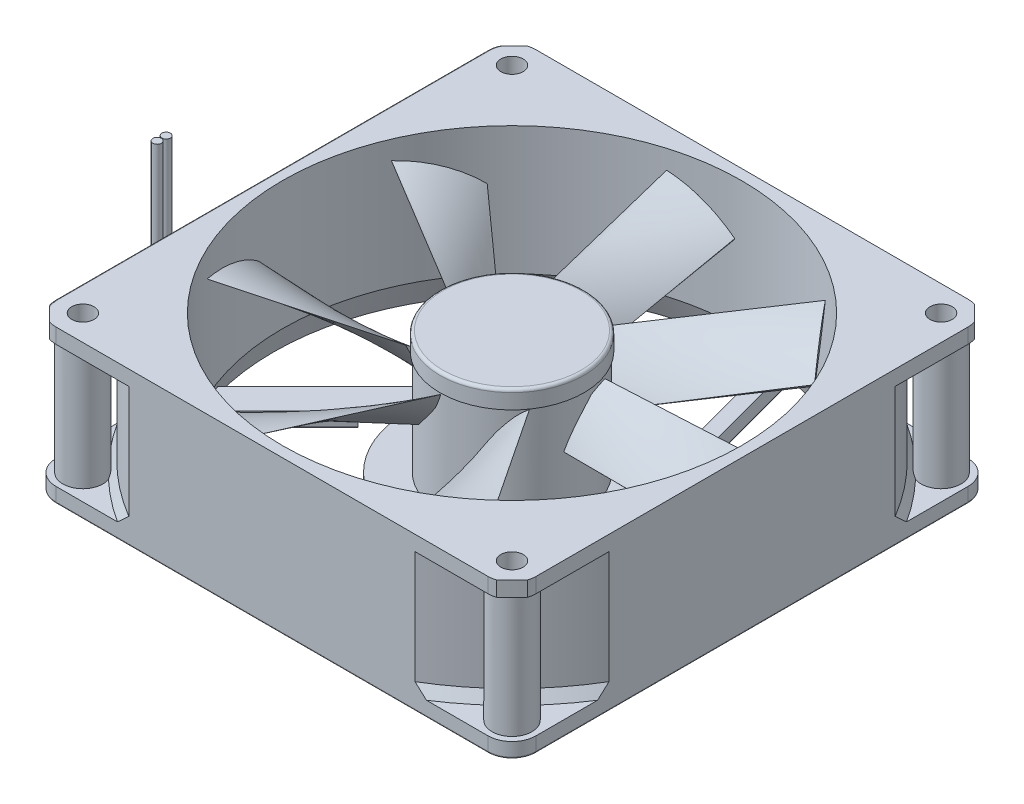
from build123d import *

# Parameters (mm, degrees)
SKETCH1_W                    = 80
SKETCH1_H                    = 80
MAIN_BODY_DEPTH              = 25.5
SKETCH2_R                    = 38.25
FAN_HOLE_CUT_DEPTH           = 63.050382755
FAN_HOLE_FRONT_CHAMFER_SIZE  = 1.5
FAN_HOLE_FRONT_CHAMFER_SIZE2 = 4.121216129
FAN_SUPPORT_DEPTH            = 2.5
SKETCH4_R                    = 11.75
PCB_DEPTH                    = 17.5
SKETCH5_R                    = 12
FAN_BODY_DEPTH               = 3
SKETCH6_W                    = 10
SKETCH6_H                    = 20.5
SKETCH7_R                    = 3.33
MOUNT_SCREW_EXTRUDE_DEPTH    = 25.5
SKETCH8_R                    = 1.85
MOUNT_SCREW_HOLES_DEPTH      = 25.5
CORNER_FILLETS_R             = 4
FAN_BLADES_CIRPATTERN_COUNT  = 7
SKETCH12_R                   = 55
SKETCH12_R_2                 = 54.5
FAN_BLADE_END_TRIM_DEPTH     = 23
WIRE_CHANNEL_DEPTH           = 2
SKETCH17_R                   = 10
LABEL_DEPTH                  = 0.2
LABEL_TEXT_DEPTH             = 0.05
FRONT_EDGE_FILLET_R          = 0.25
REAR_EDGE_FILLET_R           = 0.25
FAN_BODY_FILLET_R            = 0.5
OUTER_CUT_CHAMFER_SIZE       = 1.732050808
OUTER_CUT_CHAMFER_SIZE_2     = 1
SKETCH19_R                   = 0.71


# Some blends are built 0.0001 mm under size
with BuildPart() as part:
    # Sketch1 → Main Body (new body)
    with BuildSketch(Plane(origin=(0, 0, 0), x_dir=(1, 0, 0), z_dir=(0, 1, 0))):
        Rectangle(SKETCH1_W, SKETCH1_H)
    extrude(amount=MAIN_BODY_DEPTH)

    # Sketch2 → Fan Hole Cut (cut, through all)
    with BuildSketch(Plane.XZ):
        with Locations(Location((0, 0, 0), (0, 0, 270))):
            Circle(SKETCH2_R)
    extrude(amount=-FAN_HOLE_CUT_DEPTH, mode=Mode.SUBTRACT)

    # Fan Hole Front Chamfer
    fan_hole_front_chamfer_edges = [part.edges().sort_by_distance(p)[0] for p in [
        (0, 0, 38.25),
    ]]
    fan_hole_front_chamfer_side = [part.faces().sort_by_distance(p)[0] for p in [
        (0, 0, -38.86862915),
    ]]
    chamfer(fan_hole_front_chamfer_edges, length=FAN_HOLE_FRONT_CHAMFER_SIZE, length2=FAN_HOLE_FRONT_CHAMFER_SIZE2, reference=fan_hole_front_chamfer_side[0])

    # Sketch3 → Fan Support (add)
    with BuildSketch(Plane.XZ):
        with BuildLine():
            Line((-4.529333289, 16.90370196), (29.945052018, 26.141085663))
            ThreePointArc((29.945052018, 26.141085663), (30.828125874, 25.093607853), (31.674577576, 24.016320188))
            Line((31.674577576, 24.016320188), (4.824452061, 16.82185074))
            ThreePointArc((4.824452061, 16.82185074), (15.231429157, 8.617050879), (16.90370196, -4.529333289))
            Line((16.90370196, -4.529333289), (7.666318257, -39.003718597))
            ThreePointArc((7.666318257, -39.003718597), (6.317638936, -39.244744085), (4.9614546, -39.439148929))
            Line((4.9614546, -39.439148929), (12.155924049, -12.589023414))
            ThreePointArc((12.155924049, -12.589023414), (-0.153129611, -17.499330025), (-12.374368671, -12.374368671))
            Line((-12.374368671, -12.374368671), (-37.611370276, 12.862632934))
            ThreePointArc((-37.611370276, 12.862632934), (-36.650573499, 15.388241036), (-35.52040612, 17.842736591))
            Line((-35.52040612, 17.842736591), (-17.499088803, -0.178580727))
            ThreePointArc((-17.499088803, -0.178580727), (-13.937859965, 10.582346601), (-4.529333289, 16.90370196))
        make_face()
    extrude(amount=-FAN_SUPPORT_DEPTH)

    # Sketch4 → PCB (add)
    with BuildSketch(Plane(origin=(0, 2.5, 0), x_dir=(-1, 0, 0), z_dir=(0, 1, 0))):
        with Locations(Location((0, 0, 0), (0, 0, 270))):
            Circle(SKETCH4_R)
    extrude(amount=PCB_DEPTH)

    # Sketch5 → Fan Body (add)
    with BuildSketch(Plane(origin=(0, 20, 0), x_dir=(-1, 0, 0), z_dir=(0, 1, 0))):
        with Locations(Location((0, 0, 0), (0, 0, 90))):
            Circle(SKETCH5_R)
    extrude(amount=FAN_BODY_DEPTH)

    # Sketch6 → Outer Cut-Revolve1 (revolve, cut)
    with BuildSketch(Plane(origin=(0, 0, 0), x_dir=(-0.7071067811865474, 0, 0.7071067811865478), z_dir=(-0.7071067811865478, 0, -0.7071067811865474))):
        with Locations((-51.568542495, 12.75)):
            Rectangle(SKETCH6_W, SKETCH6_H)
    revolve(axis=Axis((0, 25.5, 0), (0, -1, 0)), mode=Mode.SUBTRACT)

    # Sketch7 → Mount Screw Extrude (add)
    with BuildSketch(Plane(origin=(0, 0, 0), x_dir=(1, 0, 0), z_dir=(0, 1, 0))):
        with Locations(Location((35.75, 35.75, 0), (0, 0, 90))):
            Circle(SKETCH7_R)
        with Locations(Location((-35.75, 35.75, 0), (0, 0, 90))):
            Circle(SKETCH7_R)
        with Locations(Location((-35.75, -35.75, 0), (0, 0, 90))):
            Circle(SKETCH7_R)
        with Locations(Location((35.75, -35.75, 0), (0, 0, 90))):
            Circle(SKETCH7_R)
    extrude(amount=MOUNT_SCREW_EXTRUDE_DEPTH)

    # Sketch8 → Mount Screw Holes (cut)
    with BuildSketch(Plane(origin=(0, 0, 0), x_dir=(1, 0, 0), z_dir=(0, 1, 0))):
        with Locations(Location((35.75, 35.75, 0), (0, 0, 270))):
            Circle(SKETCH8_R)
        with Locations(Location((-35.75, 35.75, 0), (0, 0, 270))):
            Circle(SKETCH8_R)
        with Locations(Location((-35.75, -35.75, 0), (0, 0, 270))):
            Circle(SKETCH8_R)
        with Locations(Location((35.75, -35.75, 0), (0, 0, 270))):
            Circle(SKETCH8_R)
    extrude(amount=MOUNT_SCREW_HOLES_DEPTH, mode=Mode.SUBTRACT)

    # Corner Fillets
    corner_fillets_edges = [part.edges().sort_by_distance(p)[0] for p in [
        (-40, 1.25, -40),
        (40, 1.25, -40),
        (-40, 24.25, -40),
        (40, 24.25, -40),
        (40, 1.25, 40),
        (40, 24.25, 40),
        (-40, 24.25, 40),
        (-40, 1.25, 40),
    ]]
    fillet(corner_fillets_edges, radius=CORNER_FILLETS_R)

    # Sketch11 for Fan Blade → Fan Blade section 0
    with BuildSketch(Plane.XY.offset(-36)):
        with BuildLine():
            Line((0.88314284, 18.423934195), (1.116801935, 18.804017109))
            # circular arc as an exact rational Bezier (weights 1, cos(half-angle), 1)
            Bezier((1.116801935, 18.804017109), (-3.902507001, 22.677639097), (-10.234528239, 23), weights=[1, 0.954384892, 1])
            Bezier((-10.234528239, 23), (-4.950325999, 20.044738342), (0.88314284, 18.423934195), weights=[1, 0.992873278, 1])
        make_face()
    # Sketch10 for Fan Blade → Fan Blade section 1
    with BuildSketch(Plane.XY.offset(-11)):
        with BuildLine():
            Line((-0.264841591, 12.120041066), (0.154505279, 12.376596125))
            Bezier((0.154505279, 12.376596125), (-1.729772728, 17.300194782), (-6.030014715, 20.349825284), weights=[1, 0.957029937, 1])
            Bezier((-6.030014715, 20.349825284), (-3.649909268, 15.882932376), (-0.264841591, 12.120041066), weights=[1, 0.992626589, 1])
        make_face()
    fan_blade = loft()

    # Fan Blades CirPattern: Fan Blade ×7 about axis
    fan_blades_cirpattern_axis = Axis((0, 25.5, 0), (0, -1, 0))
    for i in range(1, FAN_BLADES_CIRPATTERN_COUNT):
        add(fan_blade.rotate(fan_blades_cirpattern_axis, i * 360 / FAN_BLADES_CIRPATTERN_COUNT))

    # Sketch12 → Fan Blade End Trim (cut)
    with BuildSketch(Plane(origin=(0, 25.5, 0), x_dir=(-1, 0, 0), z_dir=(0, 1, 0))):
        Circle(SKETCH12_R)
        Circle(SKETCH12_R_2, mode=Mode.SUBTRACT)
    extrude(amount=-FAN_BLADE_END_TRIM_DEPTH, mode=Mode.SUBTRACT)

    # Sketch13 → Wire Channel (cut)
    with BuildSketch(Plane.XZ):
        with BuildLine():
            Line((-40, 20.908116908), (-40, 16.665476221))
            Line((-40, 16.665476221), (-20.213203436, -3.121320344))
            ThreePointArc((-20.213203436, -3.121320344), (-19.239933389, -3.771638598), (-18.091883092, -4))
            Line((-18.091883092, -4), (-5.355287716, -4))
            Line((-5.355287716, -4), (-5.355287716, 4))
            Line((-5.355287716, 4), (-23.091883092, 4))
            Line((-23.091883092, 4), (-40, 20.908116908))
        make_face()
    extrude(amount=-WIRE_CHANNEL_DEPTH, mode=Mode.SUBTRACT)

    # Sketch17 → Label (add)
    with BuildSketch(Plane.XZ):
        with Locations(Location((0, 0, 0), (0, 0, 156.421821522))):
            Circle(SKETCH17_R)
    extrude(amount=LABEL_DEPTH)

    # Sketch18 → Label Text (add)
    # profile 1 of 12: a face of its own
    with BuildSketch(Plane.XZ.offset(0.2)):
        with BuildLine():
            Line((6.438054702, 4.24314157), (6.438054702, 3.221225985))
            add(Edge.make_bspline(
                [(6.438054702, 3.221225985), (6.437668392, 3.194554514), (6.436927311, 3.143389139), (6.429103805, 3.07010455), (6.416754792, 3.003656938), (6.399671802, 2.943974802), (6.376775339, 2.891280433), (6.348888839, 2.845405839), (6.315575768, 2.806595257), (6.277343095, 2.774780225), (6.234162227, 2.750413135), (6.186837234, 2.732366857), (6.135294888, 2.721023765), (6.079485942, 2.71690301), (6.019467861, 2.719022888), (5.955277525, 2.728406597), (5.886859954, 2.743816246), (5.840683002, 2.758599184), (5.816707299, 2.766274687)],
                knots=[0, 0, 0, 0, 1.321239014, 2.534606635, 3.646893816, 4.667198731, 5.603797824, 6.485657792, 7.317482625, 8.126881878, 8.937584847, 9.763010098, 10.628279458, 11.542958389, 12.528970477, 13.598371646, 14.753041856, 16, 16, 16, 16], degree=3))
            add(Edge.make_bspline(
                [(5.816707299, 2.766274687), (5.791655003, 2.775209779), (5.742303896, 2.792811227), (5.671983228, 2.82576358), (5.605640356, 2.862101412), (5.543541238, 2.903027162), (5.48547448, 2.947939147), (5.431747724, 2.997366053), (5.381891195, 3.050571146), (5.336957146, 3.10847267), (5.29592326, 3.170091629), (5.261288845, 3.236549527), (5.231380621, 3.306783483), (5.207124323, 3.381063341), (5.188458201, 3.459542995), (5.17528234, 3.541891146), (5.166938037, 3.62838736), (5.16587258, 3.687386103), (5.165327429, 3.717573388)],
                knots=[0, 0, 0, 0, 1.02770908, 2.024508209, 2.998267434, 3.94979454, 4.8965093, 5.832985081, 6.76916876, 7.711757751, 8.663284857, 9.62710664, 10.60428651, 11.611458153, 12.643986171, 13.71956153, 14.833191325, 16, 16, 16, 16], degree=3))
            Line((5.165327429, 3.717573388), (5.165327429, 4.052394817))
            Line((5.165327429, 4.052394817), (4.438054702, 4.299553908))
            Line((4.438054702, 4.299553908), (4.438054702, 4.922930531))
            Line((4.438054702, 4.922930531), (6.438054702, 4.24314157))
        make_face()
        with BuildLine():
            Line((5.580911845, 3.91116105), (5.580911845, 3.770333128))
            add(Edge.make_bspline(
                [(5.580911845, 3.770333128), (5.581032262, 3.756935234), (5.581267309, 3.730783485), (5.58410513, 3.69283252), (5.588936941, 3.657170996), (5.595820843, 3.624112032), (5.604222071, 3.593364863), (5.614880901, 3.565138026), (5.627282012, 3.539266132), (5.646251781, 3.508513717), (5.67370437, 3.474867468), (5.711228661, 3.440772858), (5.753361291, 3.413617486), (5.784135203, 3.40146469), (5.799661845, 3.395333128)],
                knots=[0, 0, 0, 0, 1.032192763, 2.014767802, 2.930247413, 3.803196531, 4.615069746, 5.383698589, 6.124980646, 6.822224991, 8.163692905, 9.455309558, 10.716104132, 12, 12, 12, 12], degree=3))
            add(Edge.make_bspline(
                [(5.799661845, 3.395333128), (5.814549106, 3.390793224), (5.842573959, 3.382246979), (5.884751483, 3.379392335), (5.923378706, 3.38436577), (5.95279218, 3.396010251), (5.973815796, 3.410273413), (5.986830941, 3.426132826), (5.99828884, 3.445194495), (6.00685068, 3.468419444), (6.01449307, 3.495062718), (6.018726403, 3.525917891), (6.02233072, 3.560427226), (6.022422293, 3.584714596), (6.022470286, 3.597443518)],
                knots=[0, 0, 0, 0, 1.472911506, 2.772714833, 3.978307946, 5.141737742, 5.740212137, 6.368251784, 7.070626824, 7.843076147, 8.708987991, 9.696805147, 10.792903908, 12, 12, 12, 12], degree=3))
            Line((6.022470286, 3.597443518), (6.022470286, 3.760998713))
            Line((6.022470286, 3.760998713), (5.580911845, 3.91116105))
        make_face(mode=Mode.SUBTRACT)
    # profile 2 of 12: a face of its own
    with BuildSketch(Plane.XZ.offset(0.2)):
        Polygon((4.775717039, 1.559294167), (4.775717039, 2.255722739), (4.438054702, 2.47163183), (4.438054702, 3.104748713), (6.438054702, 1.692005206), (6.438054702, 0.988677284), (4.438054702, 0.922930531), (4.438054702, 1.573092869), align=None)
        Polygon((5.217275481, 1.541437024), (5.926691065, 1.520738973), (5.217275481, 1.97366105), align=None, mode=Mode.SUBTRACT)
    # profile 3 of 12: a face of its own
    with BuildSketch(Plane.XZ.offset(0.2)):
        with BuildLine():
            Line((6.438054702, 0.035349362), (6.438054702, -0.986566222))
            add(Edge.make_bspline(
                [(6.438054702, -0.986566222), (6.437668392, -1.013237694), (6.436927311, -1.064403069), (6.429103805, -1.137687658), (6.416754792, -1.20413527), (6.399671802, -1.263817406), (6.376775339, -1.316511774), (6.348888839, -1.362386369), (6.315575768, -1.401196951), (6.277343095, -1.433011982), (6.234162227, -1.457379073), (6.186837234, -1.47542535), (6.135294888, -1.486768443), (6.079485942, -1.490889198), (6.019467861, -1.488769319), (5.955277525, -1.479385611), (5.886859954, -1.463975962), (5.840683002, -1.449193024), (5.816707299, -1.441517521)],
                knots=[0, 0, 0, 0, 1.321239014, 2.534606635, 3.646893816, 4.667198731, 5.603797824, 6.485657792, 7.317482625, 8.126881878, 8.937584847, 9.763010098, 10.628279458, 11.542958389, 12.528970477, 13.598371646, 14.753041856, 16, 16, 16, 16], degree=3))
            add(Edge.make_bspline(
                [(5.816707299, -1.441517521), (5.791655003, -1.432582429), (5.742303896, -1.414980981), (5.671983228, -1.382028628), (5.605640356, -1.345690796), (5.543541238, -1.304765046), (5.48547448, -1.25985306), (5.431747724, -1.210426155), (5.381891195, -1.157221062), (5.336957146, -1.099319538), (5.29592326, -1.037700579), (5.261288845, -0.97124268), (5.231380621, -0.901008725), (5.207124323, -0.826728866), (5.188458201, -0.748249213), (5.17528234, -0.665901062), (5.166938037, -0.579404848), (5.16587258, -0.520406105), (5.165327429, -0.49021882)],
                knots=[0, 0, 0, 0, 1.02770908, 2.024508209, 2.998267434, 3.94979454, 4.8965093, 5.832985081, 6.76916876, 7.711757751, 8.663284857, 9.62710664, 10.60428651, 11.611458153, 12.643986171, 13.71956153, 14.833191325, 16, 16, 16, 16], degree=3))
            Line((5.165327429, -0.49021882), (5.165327429, -0.155397391))
            Line((5.165327429, -0.155397391), (4.438054702, 0.0917617))
            Line((4.438054702, 0.0917617), (4.438054702, 0.715138323))
            Line((4.438054702, 0.715138323), (6.438054702, 0.035349362))
        make_face()
        with BuildLine():
            Line((5.580911845, -0.296631157), (5.580911845, -0.437459079))
            add(Edge.make_bspline(
                [(5.580911845, -0.437459079), (5.581032262, -0.450856974), (5.581267309, -0.477008723), (5.58410513, -0.514959688), (5.588936941, -0.550621212), (5.595820843, -0.583680175), (5.604222071, -0.614427344), (5.614880901, -0.642654182), (5.627282012, -0.668526076), (5.646251781, -0.699278491), (5.67370437, -0.732924739), (5.711228661, -0.767019349), (5.753361291, -0.794174722), (5.784135203, -0.806327518), (5.799661845, -0.812459079)],
                knots=[0, 0, 0, 0, 1.032192763, 2.014767802, 2.930247413, 3.803196531, 4.615069746, 5.383698589, 6.124980646, 6.822224991, 8.163692905, 9.455309558, 10.716104132, 12, 12, 12, 12], degree=3))
            add(Edge.make_bspline(
                [(5.799661845, -0.812459079), (5.814549106, -0.816998984), (5.842573959, -0.825545228), (5.884751483, -0.828399873), (5.923378706, -0.823426438), (5.95279218, -0.811781957), (5.973815796, -0.797518795), (5.986830941, -0.781659381), (5.99828884, -0.762597713), (6.00685068, -0.739372763), (6.01449307, -0.71272949), (6.018726403, -0.681874317), (6.02233072, -0.647364981), (6.022422293, -0.623077612), (6.022470286, -0.61034869)],
                knots=[0, 0, 0, 0, 1.472911506, 2.772714833, 3.978307946, 5.141737742, 5.740212137, 6.368251784, 7.070626824, 7.843076147, 8.708987991, 9.696805147, 10.792903908, 12, 12, 12, 12], degree=3))
            Line((6.022470286, -0.61034869), (6.022470286, -0.446793495))
            Line((6.022470286, -0.446793495), (5.580911845, -0.296631157))
        make_face(mode=Mode.SUBTRACT)
    # profile 4 of 12: a face of its own
    with BuildSketch(Plane.XZ.offset(0.2)):
        with BuildLine():
            Line((5.102827429, -1.432994794), (5.139353403, -2.068546742))
            add(Edge.make_bspline(
                [(5.139353403, -2.068546742), (5.117096382, -2.064166446), (5.075652555, -2.056010089), (5.016763686, -2.051253897), (4.96586012, -2.053335859), (4.935934192, -2.061819806), (4.92222678, -2.065705833)],
                knots=[0, 0, 0, 0, 1.23814647, 2.305498509, 3.223842548, 4, 4, 4, 4], degree=3))
            add(Edge.make_bspline(
                [(4.92222678, -2.065705833), (4.912577447, -2.069831508), (4.893796144, -2.077861655), (4.869041, -2.095427958), (4.848004611, -2.116389197), (4.830833382, -2.140983872), (4.817655887, -2.169288619), (4.808586892, -2.201070288), (4.802794985, -2.236358271), (4.80206965, -2.261027772), (4.801691065, -2.273903885)],
                knots=[0, 0, 0, 0, 0.975390683, 1.898484477, 2.807532068, 3.730625862, 4.67784135, 5.702786696, 6.800981908, 8, 8, 8, 8], degree=3))
            add(Edge.make_bspline(
                [(4.801691065, -2.273903885), (4.802498272, -2.293436103), (4.804065536, -2.331359651), (4.815422837, -2.386165154), (4.835321751, -2.436284094), (4.861859796, -2.481664535), (4.894267044, -2.520357076), (4.928923876, -2.553192365), (4.966474515, -2.578600082), (4.993703163, -2.589556672), (5.007048208, -2.594926612)],
                knots=[0, 0, 0, 0, 1.155200031, 2.242924085, 3.292134734, 4.332518028, 5.33875951, 6.267446417, 7.15085738, 8, 8, 8, 8], degree=3))
            add(Edge.make_bspline(
                [(5.007048208, -2.594926612), (5.019526715, -2.598562158), (5.043479343, -2.605540628), (5.080098428, -2.607271173), (5.114806044, -2.600851149), (5.135477202, -2.590689698), (5.14584691, -2.585592196)],
                knots=[0, 0, 0, 0, 1.084010536, 2.080769929, 3.037216232, 4, 4, 4, 4], degree=3))
            add(Edge.make_bspline(
                [(5.14584691, -2.585592196), (5.151022334, -2.581717103), (5.162443938, -2.573165191), (5.177374583, -2.554403423), (5.19207808, -2.530043683), (5.206774933, -2.499610281), (5.220525307, -2.463047481), (5.23488269, -2.420757256), (5.248477605, -2.372318435), (5.257010297, -2.337916266), (5.261512494, -2.319764274)],
                knots=[0, 0, 0, 0, 0.524739567, 1.158043661, 1.934578711, 2.841114677, 3.904892628, 5.113702067, 6.477071084, 8, 8, 8, 8], degree=3))
            add(Edge.make_bspline(
                [(5.261512494, -2.319764274), (5.269049855, -2.289646017), (5.283538044, -2.231753213), (5.309365719, -2.14965124), (5.336163556, -2.075193292), (5.365399267, -2.008722956), (5.396406494, -1.950090183), (5.429449635, -1.899490998), (5.463469589, -1.855902811), (5.489656195, -1.832553026), (5.502178078, -1.821387651)],
                knots=[0, 0, 0, 0, 1.325913313, 2.548648162, 3.674782594, 4.704496492, 5.648111819, 6.503991685, 7.28464036, 8, 8, 8, 8], degree=3))
            add(Edge.make_bspline(
                [(5.502178078, -1.821387651), (5.514911096, -1.811795605), (5.540085365, -1.792831307), (5.582095977, -1.77140759), (5.626325293, -1.755449311), (5.673385076, -1.747306321), (5.722854816, -1.744890128), (5.774757627, -1.748670482), (5.829344181, -1.758945933), (5.865649522, -1.770398051), (5.884483273, -1.77633895)],
                knots=[0, 0, 0, 0, 0.947154688, 1.872606022, 2.79437287, 3.735554791, 4.702888461, 5.735967942, 6.825511188, 8, 8, 8, 8], degree=3))
            add(Edge.make_bspline(
                [(5.884483273, -1.77633895), (5.90978164, -1.786155393), (5.961309746, -1.806149677), (6.034945021, -1.84814972), (6.105838055, -1.900961847), (6.174681218, -1.962718102), (6.239115957, -2.034101), (6.29610361, -2.115419237), (6.346274842, -2.20504912), (6.380892839, -2.286497678), (6.405167886, -2.35605185), (6.420968004, -2.412306346), (6.434203605, -2.471807553), (6.445211331, -2.534638359), (6.453632667, -2.600732821), (6.459646237, -2.67018778), (6.463366855, -2.742883549), (6.463804994, -2.792432895), (6.464028728, -2.817735053)],
                knots=[0, 0, 0, 0, 1.021401127, 2.080405608, 3.18144864, 4.347238126, 5.560008286, 6.796056353, 8.080804308, 9.423411821, 10.124624676, 10.855589171, 11.623526398, 12.420468821, 13.25817982, 14.13314852, 15.046700397, 16, 16, 16, 16], degree=3))
            add(Edge.make_bspline(
                [(6.464028728, -2.817735053), (6.463753984, -2.848324999), (6.463225599, -2.907155487), (6.45603971, -2.991693658), (6.445444948, -3.069170921), (6.430174646, -3.139672421), (6.410470899, -3.203019168), (6.386680581, -3.259531772), (6.357636431, -3.308483419), (6.324784887, -3.351111272), (6.286365618, -3.386297442), (6.242593663, -3.414121053), (6.193925173, -3.435483613), (6.13974472, -3.449034421), (6.080730007, -3.456241289), (6.016502259, -3.456280115), (5.947190201, -3.449746125), (5.89983529, -3.440335619), (5.875148858, -3.435429859)],
                knots=[0, 0, 0, 0, 1.410707891, 2.713069044, 3.91068441, 5.01603595, 6.036455415, 6.96732192, 7.837447019, 8.655172524, 9.441431441, 10.227343563, 11.037773675, 11.882370742, 12.794195047, 13.773980209, 14.83956096, 16, 16, 16, 16], degree=3))
            Line((5.875148858, -3.435429859), (5.840652104, -2.800689599))
            add(Edge.make_bspline(
                [(5.840652104, -2.800689599), (5.851587468, -2.802613451), (5.872563679, -2.806303782), (5.903232353, -2.809001402), (5.931441272, -2.810098018), (5.957388147, -2.808418428), (5.981026255, -2.804794002), (6.002578789, -2.799428014), (6.021709782, -2.791096616), (6.043986485, -2.777011927), (6.067525645, -2.752890237), (6.087441771, -2.715099686), (6.098268915, -2.668426708), (6.09964968, -2.634620168), (6.100392364, -2.616436352)],
                knots=[0, 0, 0, 0, 1.037191525, 1.989540444, 2.874914227, 3.673029443, 4.415101435, 5.108165953, 5.74233749, 6.356143616, 7.563073699, 8.841521751, 10.301121969, 12, 12, 12, 12], degree=3))
            add(Edge.make_bspline(
                [(6.100392364, -2.616436352), (6.099894669, -2.60083736), (6.098938648, -2.570873324), (6.090287566, -2.527826823), (6.075714757, -2.489034474), (6.055587185, -2.454728844), (6.031716494, -2.425229779), (6.005098407, -2.400384255), (5.975720571, -2.380922358), (5.954321991, -2.372316756), (5.94373652, -2.368059729)],
                knots=[0, 0, 0, 0, 1.192946755, 2.291526244, 3.343442199, 4.35036656, 5.322236406, 6.238166495, 7.128454468, 8, 8, 8, 8], degree=3))
            add(Edge.make_bspline(
                [(5.94373652, -2.368059729), (5.936087094, -2.365803839), (5.921361376, -2.361461081), (5.898459612, -2.363222606), (5.87647326, -2.369860623), (5.864353339, -2.379383031), (5.858103403, -2.384293495)],
                knots=[0, 0, 0, 0, 1.037027792, 1.996356192, 2.966771692, 4, 4, 4, 4], degree=3))
            add(Edge.make_bspline(
                [(5.858103403, -2.384293495), (5.854736485, -2.387294618), (5.847236631, -2.393979658), (5.837832112, -2.40769274), (5.82850253, -2.425026367), (5.819264177, -2.446064475), (5.810508557, -2.470972569), (5.801555997, -2.499528043), (5.792624926, -2.531850043), (5.787390162, -2.554859609), (5.784645611, -2.566923365)],
                knots=[0, 0, 0, 0, 0.541143888, 1.205404861, 1.984936319, 2.910560029, 3.966197064, 5.160691536, 6.51137023, 8, 8, 8, 8], degree=3))
            add(Edge.make_bspline(
                [(5.784645611, -2.566923365), (5.777436275, -2.597114634), (5.763604309, -2.65504016), (5.742097432, -2.738328563), (5.720406641, -2.814283596), (5.698332883, -2.883115569), (5.676948991, -2.944845097), (5.654125077, -2.998964355), (5.632955825, -3.046620645), (5.610048508, -3.087043383), (5.586973998, -3.12238827), (5.562672222, -3.153606169), (5.53710202, -3.181414251), (5.509936692, -3.205585992), (5.481714151, -3.226766793), (5.451919245, -3.24435638), (5.420710142, -3.258276839), (5.388302372, -3.268761131), (5.354704506, -3.276056335), (5.320216187, -3.280479061), (5.284783896, -3.282133485), (5.248456644, -3.280673283), (5.21095969, -3.27728933), (5.172570351, -3.269984236), (5.132962995, -3.261007636), (5.106823166, -3.252346602), (5.093493013, -3.247929859)],
                knots=[0, 0, 0, 0, 1.954233659, 3.749428709, 5.415411101, 6.926515922, 8.30040468, 9.526233733, 10.623766169, 11.580921462, 12.447880865, 13.279303009, 14.068836087, 14.822838694, 15.565548193, 16.287153388, 16.996285579, 17.712745394, 18.427786273, 19.157787157, 19.899568177, 20.658031384, 21.445356231, 22.267345297, 23.116422969, 24, 24, 24, 24], degree=3))
            add(Edge.make_bspline(
                [(5.093493013, -3.247929859), (5.077580651, -3.242187601), (5.04577019, -3.230708235), (4.999427268, -3.209644078), (4.953612853, -3.186296058), (4.909320564, -3.158755643), (4.865175258, -3.12938726), (4.822652212, -3.09619638), (4.780680825, -3.06045213), (4.739924048, -3.021804936), (4.701243729, -2.980328347), (4.663997426, -2.93755638), (4.630166142, -2.892138531), (4.597717872, -2.845678998), (4.568831655, -2.796651778), (4.541225036, -2.74647061), (4.517250971, -2.693859136), (4.494554318, -2.639938215), (4.475208043, -2.583601937), (4.458071473, -2.525279107), (4.443997573, -2.464530456), (4.432134895, -2.401732583), (4.423364112, -2.336687171), (4.416904924, -2.26954144), (4.412642259, -2.200095408), (4.412269913, -2.152968717), (4.412080676, -2.129017521)],
                knots=[0, 0, 0, 0, 0.869406598, 1.738033859, 2.615278472, 3.51110315, 4.41777044, 5.340121929, 6.28237259, 7.251551565, 8.225783632, 9.197455099, 10.165635281, 11.136036377, 12.109374243, 13.089670182, 14.079200035, 15.080224991, 16.096453832, 17.13974175, 18.204281758, 19.301052569, 20.424363576, 21.577363251, 22.768743441, 24, 24, 24, 24], degree=3))
            add(Edge.make_bspline(
                [(4.412080676, -2.129017521), (4.412216235, -2.108180959), (4.41248041, -2.067575246), (4.415119122, -2.008178573), (4.418564272, -1.951722423), (4.423858582, -1.898119122), (4.430609722, -1.847460148), (4.439289981, -1.799857003), (4.448777164, -1.755217417), (4.460207239, -1.713635864), (4.473096081, -1.674965629), (4.487810066, -1.639275865), (4.503390756, -1.606245494), (4.521017876, -1.576443852), (4.539935756, -1.549493751), (4.56085618, -1.525937945), (4.582797961, -1.504894206), (4.614398888, -1.48131449), (4.656673932, -1.456521467), (4.71104378, -1.433967472), (4.768410181, -1.417034473), (4.82917793, -1.406896725), (4.893277245, -1.404033517), (4.960502895, -1.406926281), (5.031013057, -1.416261387), (5.078422178, -1.427308146), (5.102827429, -1.432994794)],
                knots=[0, 0, 0, 0, 1.241238634, 2.418891308, 3.541481368, 4.610457218, 5.627145034, 6.585152786, 7.492532483, 8.3449928, 9.152896069, 9.919166659, 10.643698315, 11.326507995, 11.979511192, 12.601959322, 13.200576857, 13.787303591, 14.946976628, 16.110005369, 17.285698439, 18.503321455, 19.770274958, 21.101257504, 22.507786318, 24, 24, 24, 24], degree=3))
        make_face()
    # profile 5 of 12: a face of its own
    with BuildSketch(Plane.XZ.offset(0.2)):
        Polygon((6.438054702, -3.88672856), (6.438054702, -5.75685843), (5.970522234, -5.597767521), (5.970522234, -4.974390898), (4.438054702, -4.453692846), (4.438054702, -3.830316222), (5.970522234, -4.351014274), (5.970522234, -3.727637651), align=None)
    # profile 6 of 12: a face of its own
    with BuildSketch(Plane.XZ.offset(0.2)):
        Polygon((2.478822719, 7.112319327), (2.478822719, 7.462192637), (1.584397043, 7.462192637), (1.584397043, 7.593949394), (2.478822719, 7.593949394), (2.478822719, 7.941077773), (2.589886908, 7.941077773), (2.589886908, 7.112319327), align=None)
    # profile 7 of 12: a face of its own
    with BuildSketch(Plane.XZ.offset(0.2)):
        Polygon((2.589886908, 6.11337507), (1.968476435, 6.528282165), (1.584397043, 6.528282165), (1.584397043, 6.659405475), (1.968476435, 6.659405475), (2.589886908, 7.072623381), (2.589886908, 6.926508516), (2.073206165, 6.593738246), (2.589886908, 6.251043989), align=None)
    # profile 8 of 12: a face of its own
    with BuildSketch(Plane.XZ.offset(0.2)):
        with BuildLine():
            Line((2.589886908, 5.98985311), (2.589886908, 5.566711219))
            add(Edge.make_bspline(
                [(2.589886908, 5.566711219), (2.589682444, 5.553888636), (2.589282565, 5.528810923), (2.585025733, 5.492210738), (2.578933591, 5.457475091), (2.569783332, 5.424668486), (2.557873423, 5.393863976), (2.543863134, 5.364691717), (2.526695404, 5.33775175), (2.507454267, 5.31268366), (2.486026734, 5.290231332), (2.463062999, 5.270580196), (2.438637887, 5.253991888), (2.412714991, 5.240384176), (2.385293457, 5.229785367), (2.356419819, 5.222143418), (2.326091742, 5.217669107), (2.305414083, 5.217117871), (2.294912246, 5.216837908)],
                knots=[0, 0, 0, 0, 1.19836409, 2.343695477, 3.440862327, 4.493077171, 5.522132484, 6.52574879, 7.513511173, 8.503375834, 9.476206066, 10.409851199, 11.324304258, 12.230933306, 13.141399526, 14.067219118, 15.018372914, 16, 16, 16, 16], degree=3))
            add(Edge.make_bspline(
                [(2.294912246, 5.216837908), (2.284195608, 5.217100027), (2.263160139, 5.217614535), (2.232293876, 5.222327698), (2.202608105, 5.229249533), (2.174349508, 5.239888328), (2.147176459, 5.252931897), (2.121306672, 5.269042595), (2.096907231, 5.288321792), (2.073778759, 5.310081795), (2.052633335, 5.33454275), (2.034199596, 5.361444732), (2.01875266, 5.390605569), (2.006027078, 5.421869335), (1.996091053, 5.455313133), (1.989259762, 5.490965758), (1.984929057, 5.528738819), (1.984382263, 5.554663458), (1.984101435, 5.56797811)],
                knots=[0, 0, 0, 0, 0.976463228, 1.916679622, 2.841216179, 3.75079895, 4.663500378, 5.585896388, 6.523019777, 7.494472486, 8.477304363, 9.465193261, 10.461384589, 11.48028108, 12.538123678, 13.636831942, 14.786298951, 16, 16, 16, 16], degree=3))
            Line((1.984101435, 5.56797811), (1.984101435, 5.8587298))
            Line((1.984101435, 5.8587298), (1.584397043, 5.8587298))
            Line((1.584397043, 5.8587298), (1.584397043, 5.98985311))
            Line((1.584397043, 5.98985311), (2.589886908, 5.98985311))
        make_face()
        with BuildLine():
            Line((2.095376773, 5.8587298), (2.095376773, 5.581702773))
            add(Edge.make_bspline(
                [(2.095376773, 5.581702773), (2.095525148, 5.572757056), (2.095814349, 5.555320746), (2.098449941, 5.53000443), (2.102351669, 5.506188239), (2.108063676, 5.483928489), (2.115384536, 5.463170497), (2.124516896, 5.444103151), (2.135128278, 5.426574456), (2.147398258, 5.410722184), (2.161121649, 5.396535807), (2.17621285, 5.384203388), (2.192624338, 5.373716136), (2.210403404, 5.365351975), (2.229359975, 5.358707352), (2.249630086, 5.354175725), (2.271096201, 5.351051019), (2.285891498, 5.3508226), (2.293434205, 5.350706151)],
                knots=[0, 0, 0, 0, 1.243079824, 2.42291659, 3.534287429, 4.594939236, 5.6130011, 6.588821085, 7.528413798, 8.455960281, 9.369208367, 10.266118337, 11.159017659, 12.069221401, 12.991230862, 13.945228757, 14.952468667, 16, 16, 16, 16], degree=3))
            add(Edge.make_bspline(
                [(2.293434205, 5.350706151), (2.300198606, 5.350939763), (2.313431427, 5.351396764), (2.332799198, 5.354071255), (2.351122175, 5.359014921), (2.368431039, 5.36580846), (2.384932408, 5.37422043), (2.40017448, 5.384988085), (2.414602822, 5.397446233), (2.427863381, 5.41185788), (2.439938869, 5.427845483), (2.45025558, 5.445555651), (2.459266461, 5.464648803), (2.466223217, 5.485327691), (2.472099102, 5.507297563), (2.476001229, 5.530769581), (2.47831626, 5.555754829), (2.478650898, 5.572899721), (2.478822719, 5.581702773)],
                knots=[0, 0, 0, 0, 0.973866268, 1.905120358, 2.806981082, 3.698713683, 4.577753378, 5.465795399, 6.377840569, 7.316941442, 8.279358792, 9.255803589, 10.261962018, 11.312824711, 12.391543056, 13.532406627, 14.733013182, 16, 16, 16, 16], degree=3))
            Line((2.478822719, 5.581702773), (2.478822719, 5.8587298))
            Line((2.478822719, 5.8587298), (2.095376773, 5.8587298))
        make_face(mode=Mode.SUBTRACT)
    # profile 9 of 12: a face of its own
    with BuildSketch(Plane.XZ.offset(0.2)):
        with BuildLine():
            add(Edge.make_bspline(
                [(2.192927448, 4.493231489), (2.196126024, 4.481659333), (2.202492389, 4.458626407), (2.208926415, 4.423602972), (2.212880214, 4.388593825), (2.213373848, 4.365285684), (2.213620016, 4.353662232)],
                knots=[0, 0, 0, 0, 1.017264412, 2.02473732, 3.01496344, 4, 4, 4, 4], degree=3))
            add(Edge.make_bspline(
                [(2.213620016, 4.353662232), (2.213427313, 4.340417293), (2.213050085, 4.314489465), (2.208624202, 4.276668434), (2.201972001, 4.240774208), (2.192569873, 4.20683967), (2.179985596, 4.175099194), (2.165021216, 4.145308182), (2.147123783, 4.117673001), (2.126698947, 4.092259237), (2.10422686, 4.069138998), (2.079525925, 4.049256691), (2.053234384, 4.03212053), (2.024933191, 4.018454319), (1.995034374, 4.007550772), (1.96328206, 4.000060694), (1.92984376, 3.995241675), (1.906908634, 3.994749482), (1.895207854, 3.994498381)],
                knots=[0, 0, 0, 0, 1.175145952, 2.300424427, 3.375028993, 4.41342746, 5.42045379, 6.401167077, 7.368152767, 8.337033757, 9.291301545, 10.224099128, 11.146037622, 12.070892781, 13.007657157, 13.965334258, 14.961977492, 16, 16, 16, 16], degree=3))
            add(Edge.make_bspline(
                [(1.895207854, 3.994498381), (1.883367798, 3.994754866), (1.86015527, 3.995257707), (1.826194535, 4.000015152), (1.793942782, 4.007817592), (1.763330472, 4.018692016), (1.734156128, 4.032353687), (1.706873331, 4.049643455), (1.681198215, 4.069882468), (1.657121847, 4.092778859), (1.635512541, 4.118446476), (1.616610523, 4.146248085), (1.600628329, 4.176021288), (1.587862224, 4.207807717), (1.577617112, 4.241493026), (1.570258134, 4.277098606), (1.56604528, 4.314779556), (1.565474792, 4.340490061), (1.565182516, 4.353662232)],
                knots=[0, 0, 0, 0, 1.036281355, 2.03163826, 2.995767696, 3.937254529, 4.871796911, 5.810556635, 6.758656682, 7.730711463, 8.714727577, 9.690779271, 10.669609392, 11.667576811, 12.685273544, 13.748921305, 14.846712973, 16, 16, 16, 16], degree=3))
            add(Edge.make_bspline(
                [(1.565182516, 4.353662232), (1.56547878, 4.368311782), (1.566065422, 4.397319823), (1.570381689, 4.440364909), (1.577529123, 4.482497472), (1.587724294, 4.523677432), (1.600593125, 4.564006911), (1.616529122, 4.603249899), (1.635034015, 4.641742299), (1.649663048, 4.666266398), (1.657032178, 4.678620002)],
                knots=[0, 0, 0, 0, 1.027454133, 2.034494664, 3.031171617, 4.022601574, 5.007767522, 5.997869078, 6.991460032, 8, 8, 8, 8], degree=3))
            Line((1.657032178, 4.678620002), (1.759650421, 4.642302435))
            add(Edge.make_bspline(
                [(1.759650421, 4.642302435), (1.752867292, 4.631134754), (1.739463618, 4.609067068), (1.722492892, 4.574721894), (1.707840154, 4.540265574), (1.695685868, 4.505533537), (1.686370619, 4.47044552), (1.679902741, 4.435068774), (1.67564229, 4.399445038), (1.675201088, 4.375563447), (1.674979813, 4.363586219)],
                knots=[0, 0, 0, 0, 1.061853592, 2.098255757, 3.111090262, 4.104585832, 5.087261954, 6.059183477, 7.026630937, 8, 8, 8, 8], degree=3))
            add(Edge.make_bspline(
                [(1.674979813, 4.363586219), (1.675218501, 4.355415997), (1.675688977, 4.339311692), (1.678327651, 4.315674614), (1.683288447, 4.293082255), (1.690015826, 4.271607295), (1.698508762, 4.251044548), (1.709044999, 4.231644653), (1.721699489, 4.213354903), (1.735881108, 4.196168879), (1.751659893, 4.180517171), (1.768836271, 4.166977874), (1.787083399, 4.155468916), (1.806522595, 4.14615506), (1.826986881, 4.138645499), (1.848784873, 4.133726421), (1.871597816, 4.130404632), (1.887242209, 4.130033588), (1.895207854, 4.129844665)],
                knots=[0, 0, 0, 0, 1.08955317, 2.147615853, 3.165464819, 4.168630093, 5.144564689, 6.127153665, 7.105836426, 8.105484279, 9.094193138, 10.062927839, 11.015853071, 11.964378702, 12.932067474, 13.915373145, 14.938571982, 16, 16, 16, 16], degree=3))
            add(Edge.make_bspline(
                [(1.895207854, 4.129844665), (1.902886677, 4.130066564), (1.917950404, 4.130501871), (1.94001113, 4.13335311), (1.960825491, 4.138790849), (1.980489994, 4.145849685), (1.998940007, 4.15513445), (2.016293806, 4.166287771), (2.032443064, 4.179701931), (2.047091032, 4.195125077), (2.060419755, 4.21199708), (2.072069143, 4.230255907), (2.082010744, 4.249682059), (2.090063364, 4.270267739), (2.096181139, 4.291996389), (2.10054234, 4.314813702), (2.103428508, 4.338808243), (2.103689328, 4.355201978), (2.103822719, 4.363586219)],
                knots=[0, 0, 0, 0, 1.046580221, 2.05310086, 3.023177782, 3.972936706, 4.895174766, 5.831667431, 6.778515953, 7.748592875, 8.725285753, 9.7044246, 10.695331468, 11.694559215, 12.711672468, 13.766962852, 14.857958848, 16, 16, 16, 16], degree=3))
            add(Edge.make_bspline(
                [(2.103822719, 4.363586219), (2.103550181, 4.37500494), (2.10300808, 4.397717712), (2.098300761, 4.431309497), (2.091398532, 4.464356685), (2.084064137, 4.485554691), (2.080385219, 4.49618757)],
                knots=[0, 0, 0, 0, 1.011989988, 2.012931064, 3.003290015, 4, 4, 4, 4], degree=3))
            Line((2.080385219, 4.49618757), (2.101077786, 4.604506827))
            Line((2.101077786, 4.604506827), (2.589886908, 4.604506827))
            Line((2.589886908, 4.604506827), (2.589886908, 4.036516962))
            Line((2.589886908, 4.036516962), (2.473121705, 4.036516962))
            Line((2.473121705, 4.036516962), (2.473121705, 4.493231489))
            Line((2.473121705, 4.493231489), (2.192927448, 4.493231489))
        make_face()
    # profile 10 of 12: a face of its own
    with BuildSketch(Plane.XZ.offset(0.2)):
        with BuildLine():
            Line((1.584397043, 3.391035543), (1.584397043, 3.519202773))
            Line((1.584397043, 3.519202773), (2.420967989, 3.519202773))
            add(Edge.make_bspline(
                [(2.420967989, 3.519202773), (2.413799627, 3.526920116), (2.399394735, 3.542428192), (2.381318103, 3.568862058), (2.366025112, 3.597571916), (2.353633046, 3.628632104), (2.343582182, 3.661936923), (2.336738004, 3.697739511), (2.332758378, 3.735961882), (2.332167506, 3.762225137), (2.331863259, 3.775748381)],
                knots=[0, 0, 0, 0, 0.905912707, 1.820440187, 2.747670461, 3.701994235, 4.695185764, 5.73872437, 6.835643845, 8, 8, 8, 8], degree=3))
            Line((2.331863259, 3.775748381), (2.451584543, 3.775748381))
            add(Edge.make_bspline(
                [(2.451584543, 3.775748381), (2.451992609, 3.759391456), (2.45278284, 3.727715866), (2.459932528, 3.682047195), (2.471161516, 3.63984963), (2.487298361, 3.601242049), (2.508135267, 3.566195752), (2.533797997, 3.534971349), (2.563765822, 3.506978834), (2.586822154, 3.491985741), (2.598544002, 3.484363246)],
                knots=[0, 0, 0, 0, 1.145374999, 2.218046972, 3.230130326, 4.19820989, 5.140356593, 6.076144937, 7.021911306, 8, 8, 8, 8], degree=3))
            Line((2.598544002, 3.484363246), (2.598544002, 3.391035543))
            Line((2.598544002, 3.391035543), (1.584397043, 3.391035543))
        make_face()
    # profile 11 of 12: a face of its own
    with BuildSketch(Plane.XZ.offset(0.2)):
        with BuildLine():
            Line((1.584397043, 2.379844665), (1.584397043, 3.048341286))
            Line((1.584397043, 3.048341286), (1.689126773, 3.048341286))
            add(Edge.make_bspline(
                [(1.689126773, 3.048341286), (1.702697512, 3.033759816), (1.729193988, 3.005289917), (1.768229302, 2.96378876), (1.804773601, 2.923711072), (1.840013265, 2.886078697), (1.872853286, 2.849886027), (1.903852481, 2.815778427), (1.932922529, 2.783543973), (1.960061965, 2.753128113), (1.985955061, 2.724485925), (2.011186528, 2.698041516), (2.035646459, 2.673423531), (2.059647901, 2.651031415), (2.082787168, 2.630292404), (2.105307727, 2.61153705), (2.127157593, 2.594691286), (2.148500186, 2.579875946), (2.169586571, 2.566797448), (2.190742162, 2.555562371), (2.212066117, 2.546092417), (2.233389975, 2.538148514), (2.254912401, 2.532318063), (2.276384061, 2.527759294), (2.298087088, 2.525192595), (2.312572107, 2.524859492), (2.319827786, 2.524692637)],
                knots=[0, 0, 0, 0, 1.707698805, 3.334232549, 4.884342612, 6.35737616, 7.754032749, 9.073975281, 10.308692422, 11.475240543, 12.568698308, 13.618602541, 14.608461745, 15.543331896, 16.432267557, 17.272047018, 18.055296996, 18.796783571, 19.498434176, 20.181335652, 20.848515061, 21.497548567, 22.129961102, 22.758330775, 23.378036487, 24, 24, 24, 24], degree=3))
            add(Edge.make_bspline(
                [(2.319827786, 2.524692637), (2.32652505, 2.524829474), (2.339696982, 2.525098598), (2.358850371, 2.527958985), (2.377029061, 2.532281346), (2.393913772, 2.538787303), (2.410045983, 2.546487835), (2.424790427, 2.556587462), (2.438603635, 2.568245829), (2.451266025, 2.581567762), (2.462584235, 2.596327736), (2.472623385, 2.612169442), (2.480771671, 2.629266646), (2.487838557, 2.647131188), (2.49308651, 2.666183504), (2.496902892, 2.686160137), (2.498948583, 2.707294196), (2.499322986, 2.721690376), (2.499515286, 2.729084529)],
                knots=[0, 0, 0, 0, 1.048546869, 2.062243418, 3.027769524, 3.969965062, 4.892201818, 5.821989676, 6.760952973, 7.720351099, 8.695277629, 9.671326125, 10.652779381, 11.658285281, 12.677723843, 13.743981574, 14.841265819, 16, 16, 16, 16], degree=3))
            add(Edge.make_bspline(
                [(2.499515286, 2.729084529), (2.499344385, 2.739582513), (2.498999293, 2.760780581), (2.495119194, 2.792716093), (2.489424005, 2.825069968), (2.48167859, 2.857926494), (2.471156488, 2.891048064), (2.458657975, 2.924746412), (2.443988681, 2.958928096), (2.4325014, 2.98139974), (2.426669002, 2.992809192)],
                knots=[0, 0, 0, 0, 0.911610196, 1.840770153, 2.790782305, 3.765197564, 4.770882983, 5.807905198, 6.887015191, 8, 8, 8, 8], degree=3))
            Line((2.426669002, 2.992809192), (2.5286538, 3.029126759))
            add(Edge.make_bspline(
                [(2.5286538, 3.029126759), (2.535053685, 3.016735817), (2.547761071, 2.992132801), (2.564289463, 2.954324688), (2.577925737, 2.915947271), (2.589520855, 2.877319612), (2.598050825, 2.838107631), (2.604437703, 2.798647792), (2.608382146, 2.758725599), (2.608860734, 2.731979029), (2.609101435, 2.718527097)],
                knots=[0, 0, 0, 0, 1.032308732, 2.049715674, 3.051809654, 4.046001709, 5.033356604, 6.020202649, 7.004279803, 8, 8, 8, 8], degree=3))
            add(Edge.make_bspline(
                [(2.609101435, 2.718527097), (2.608866123, 2.706762739), (2.608404087, 2.683663352), (2.604547853, 2.649902825), (2.598256922, 2.617818889), (2.589363521, 2.587494917), (2.57800394, 2.558772175), (2.563707575, 2.531938019), (2.5472221, 2.506602874), (2.528247817, 2.483338272), (2.507501979, 2.462099675), (2.484665811, 2.44402602), (2.4609108, 2.428144444), (2.435333939, 2.415674484), (2.408570596, 2.405655151), (2.38021241, 2.398763176), (2.350508582, 2.39441525), (2.330189555, 2.393855019), (2.319827786, 2.393569327)],
                knots=[0, 0, 0, 0, 1.156348103, 2.270496419, 3.335804783, 4.367129935, 5.373261478, 6.366869912, 7.351449646, 8.340299842, 9.314023145, 10.263949796, 11.198631917, 12.117738572, 13.054799836, 14.003036337, 14.981640366, 16, 16, 16, 16], degree=3))
            add(Edge.make_bspline(
                [(2.319827786, 2.393569327), (2.311936371, 2.393713981), (2.296105621, 2.394004169), (2.272475024, 2.396923036), (2.248884425, 2.401304925), (2.225381356, 2.407687861), (2.201938818, 2.416005823), (2.178508687, 2.425907125), (2.155159148, 2.437601126), (2.131795972, 2.451181416), (2.108273392, 2.467064104), (2.083941899, 2.48475346), (2.059031368, 2.504876026), (2.033551931, 2.527375124), (2.007086243, 2.551811103), (1.980095827, 2.578760162), (1.952251797, 2.607804993), (1.933795285, 2.628247334), (1.924346367, 2.638712908)],
                knots=[0, 0, 0, 0, 0.789402936, 1.583599385, 2.379324907, 3.189233618, 4.017945069, 4.86700183, 5.733268508, 6.629680796, 7.569355029, 8.572465121, 9.639517653, 10.772598452, 11.973779816, 13.2438638, 14.588980271, 16, 16, 16, 16], degree=3))
            Line((1.924346367, 2.638712908), (1.701373394, 2.886601421))
            Line((1.701373394, 2.886601421), (1.701373394, 2.379844665))
            Line((1.701373394, 2.379844665), (1.584397043, 2.379844665))
        make_face()
    # profile 12 of 12: a face of its own
    with BuildSketch(Plane.XZ.offset(0.2)):
        Polygon((2.478822719, 1.0774798), (2.478822719, 1.642513583), (2.125993327, 1.642513583), (2.125993327, 1.093949394), (2.014929138, 1.093949394), (2.014929138, 1.642513583), (1.584397043, 1.642513583), (1.584397043, 1.773636894), (2.589886908, 1.773636894), (2.589886908, 1.0774798), align=None)
    extrude(amount=LABEL_TEXT_DEPTH)

    # Front Edge Fillet
    front_edge_fillet_edges = [part.edges().sort_by_distance(p)[0] for p in [
        (15.231429157, 0, 8.617050879),
        (-12.565830613, 0, 12.179897413),
        (-0.153129611, 0, -17.499330025),
        (-40, 0, 28.454058454),
        (-38.828427125, 0, 38.828427125),
        (-40, 0, -9.66726189),
        (-38.828427125, 0, -38.828427125),
        (0, 0, -40),
        (38.828427125, 0, -38.828427125),
        (40, 0, 0),
        (38.828427125, 0, 38.828427125),
        (-31.545941546, 0, 12.454058454),
        (-28.599037825, 0, 10.921368295),
        (12.285010109, 0, -21.766525943),
        (12.707859364, 0, 21.522393811),
        (18.249514818, 0, 20.419085464),
        (-24.992869473, 0, 0.244132132),
        (8.558689325, 0, -26.014086172),
        (0, 0, 40),
    ]]
    fillet(front_edge_fillet_edges, radius=FRONT_EDGE_FILLET_R - 0.0001)  # a hair under: the kernel refuses the full size

    # Rear Edge Fillet
    rear_edge_fillet_edges = [part.edges().sort_by_distance(p)[0] for p in [
        (-40, 25.5, 0),
        (-39.951845301, 25.5, 36.618804262),
        (-39.951845301, 25.5, -36.618804262),
    ]]
    fillet(rear_edge_fillet_edges, radius=REAR_EDGE_FILLET_R)

    # Fan Body Fillet
    fan_body_fillet_edges = [part.edges().sort_by_distance(p)[0] for p in [
        (0, 23, -12),
    ]]
    fillet(fan_body_fillet_edges, radius=FAN_BODY_FILLET_R)

    # Outer Cut Chamfer
    # the kernel refuses this chamfer: 1.732050808, 1 mm, written as the material it adds along each edge
    with BuildSketch(Plane(origin=(0, 2.5, 0), x_dir=(-0.427165905984868, 0, 0.9041732625797596), z_dir=(0.9041732625797596, 0, 0.427165905984868))) as outer_cut_chamfer_piece_1_section:
        Polygon((46.568542495, -OUTER_CUT_CHAMFER_SIZE), (46.568542495 + OUTER_CUT_CHAMFER_SIZE_2, 0), (46.568542495, 0), align=None)
    outer_cut_chamfer_piece_1 = revolve(axis=Axis((0, 2.5, 0), (0, -1, 0)), revolution_arc=39.424329188, mode=Mode.PRIVATE)
    outer_cut_chamfer_piece_1 = split(outer_cut_chamfer_piece_1, bisect_by=Plane(origin=(-40, 3.352056453, 33.265377177), z_dir=(1, 0, 0)), keep=Keep.TOP, mode=Mode.PRIVATE)
    outer_cut_chamfer_piece_1 = split(outer_cut_chamfer_piece_1, bisect_by=Plane(origin=(-33.265377177, 3.352056453, 40), z_dir=(0, 0, -1)), keep=Keep.TOP, mode=Mode.PRIVATE)
    add(outer_cut_chamfer_piece_1)
    with BuildSketch(Plane(origin=(0, 2.5, 0), x_dir=(0.9041732625797595, 0, 0.42716590598486853), z_dir=(0.42716590598486853, 0, -0.9041732625797595))) as outer_cut_chamfer_piece_2_section:
        Polygon((46.568542495 + OUTER_CUT_CHAMFER_SIZE_2, 0), (46.568542495, -OUTER_CUT_CHAMFER_SIZE), (46.568542495, 0), align=None)
    outer_cut_chamfer_piece_2 = revolve(axis=Axis((0, 2.5, 0), (0, -1, 0)), revolution_arc=39.424329188, mode=Mode.PRIVATE)
    outer_cut_chamfer_piece_2 = split(outer_cut_chamfer_piece_2, bisect_by=Plane(origin=(40, 3.35205645, 33.265377174), z_dir=(-1, 0, 0)), keep=Keep.TOP, mode=Mode.PRIVATE)
    outer_cut_chamfer_piece_2 = split(outer_cut_chamfer_piece_2, bisect_by=Plane(origin=(33.265377174, 3.35205645, 40), z_dir=(0, 0, -1)), keep=Keep.TOP, mode=Mode.PRIVATE)
    add(outer_cut_chamfer_piece_2)
    with BuildSketch(Plane(origin=(0, 2.5, 0), x_dir=(-0.9041732625797596, 0, -0.42716590598486787), z_dir=(-0.42716590598486787, 0, 0.9041732625797596))) as outer_cut_chamfer_piece_3_section:
        Polygon((46.568542495, -OUTER_CUT_CHAMFER_SIZE), (46.568542495 + OUTER_CUT_CHAMFER_SIZE_2, 0), (46.568542495, 0), align=None)
    outer_cut_chamfer_piece_3 = revolve(axis=Axis((0, 2.5, 0), (0, -1, 0)), revolution_arc=39.424329188, mode=Mode.PRIVATE)
    outer_cut_chamfer_piece_3 = split(outer_cut_chamfer_piece_3, bisect_by=Plane(origin=(-40, 3.352056453, -33.265377177), z_dir=(1, 0, 0)), keep=Keep.TOP, mode=Mode.PRIVATE)
    outer_cut_chamfer_piece_3 = split(outer_cut_chamfer_piece_3, bisect_by=Plane(origin=(-33.265377177, 3.352056453, -40), z_dir=(0, 0, 1)), keep=Keep.TOP, mode=Mode.PRIVATE)
    add(outer_cut_chamfer_piece_3)
    with BuildSketch(Plane(origin=(0, 2.5, 0), x_dir=(0.42716590598486803, 0, -0.9041732625797596), z_dir=(-0.9041732625797596, 0, -0.42716590598486803))) as outer_cut_chamfer_piece_4_section:
        Polygon((46.568542495 + OUTER_CUT_CHAMFER_SIZE_2, 0), (46.568542495, -OUTER_CUT_CHAMFER_SIZE), (46.568542495, 0), align=None)
    outer_cut_chamfer_piece_4 = revolve(axis=Axis((0, 2.5, 0), (0, -1, 0)), revolution_arc=39.424329188, mode=Mode.PRIVATE)
    outer_cut_chamfer_piece_4 = split(outer_cut_chamfer_piece_4, bisect_by=Plane(origin=(33.265377174, 3.35205645, -40), z_dir=(0, 0, 1)), keep=Keep.TOP, mode=Mode.PRIVATE)
    outer_cut_chamfer_piece_4 = split(outer_cut_chamfer_piece_4, bisect_by=Plane(origin=(40, 3.35205645, -33.265377174), z_dir=(-1, 0, 0)), keep=Keep.TOP, mode=Mode.PRIVATE)
    add(outer_cut_chamfer_piece_4)


with BuildPart() as body_2:
    # Sweep1: sweep along a curve in space
    with BuildLine() as sweep1_path:
        Line((0, 2, 0), (-19.970562748, 2, 0))
        ThreePointArc((-19.970562748, 2, 0), (-21.118613046, 2, 0.228361402), (-22.091883092, 2, 0.878679656))
        Line((-22.091883092, 2, 0.878679656), (-37.348530414, 2, 16.135326979))
        ThreePointArc((-37.348530414, 2, 16.135326979), (-37.835165438, 2, 16.460486106), (-38.409190586, 2, 16.574666807))
        Line((-38.409190586, 2, 16.574666807), (-40.089958003, 2, 16.574666807))
        ThreePointArc((-40.089958003, 2, 16.574666807), (-40.797064784, 2.292893219, 16.574666807), (-41.089958003, 3, 16.574666807))
        Line((-41.089958003, 3, 16.574666807), (-41.089958003, 38.123354041, 16.574666807))
    # Sketch19 → Sweep1 (sweep)
    with BuildSketch(Plane(origin=(0, 0, 0), x_dir=(0, 0, -1), z_dir=(1, 0, 0))):
        with Locations((-0.75, 1.29)):
            Circle(SKETCH19_R)
        with Locations((0.75, 1.29)):
            Circle(SKETCH19_R)
    sweep(path=sweep1_path.line)


solid = Compound([part.part, body_2.part])
